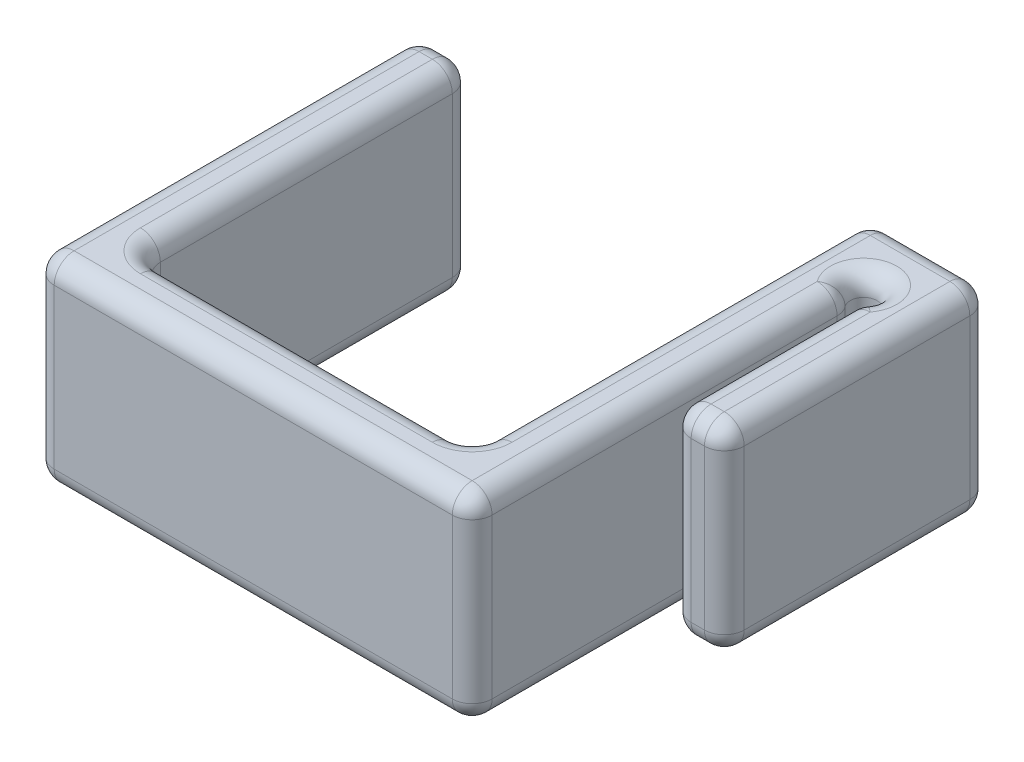
from build123d import *

# Parameters (mm, degrees)
SKETCH1_W           = 4
SKETCH1_H           = 25
BOSS_EXTRUDE1_DEPTH = 15
FILLET1_R           = 1.5
FILLET2_R           = 1.5


with BuildPart() as part:
    # Sketch1 → Boss-Extrude1 (new body)
    with BuildSketch(Plane(origin=(0, 0, 0), x_dir=(1, 0, 0), z_dir=(0, 1, 0))):
        with Locations((-29.683486239, -13.318807339)):
            Rectangle(SKETCH1_W, SKETCH1_H)
        Polygon((-2.683486239, -29.818807339), (-2.683486239, -25.818807339), (-27.683486239, -25.818807339), (-31.683486239, -25.818807339), (-31.683486239, -29.818807339), align=None)
        with BuildLine():
            Line((1.816513761, 0.181192661), (1.816513761, 4.181192661))
            Line((1.816513761, 4.181192661), (-2.683486239, 4.181192661))
            Line((-2.683486239, 4.181192661), (-2.683486239, -25.818807339))
            Line((-2.683486239, -25.818807339), (-2.683486239, -29.818807339))
            Line((-2.683486239, -29.818807339), (1.316513761, -29.818807339))
            Line((1.316513761, -29.818807339), (1.316513761, -1.684832743))
            ThreePointArc((1.316513761, -1.684832743), (0.850587935, -0.559988294), (1.816513761, 0.181192661))
        make_face()
        with BuildLine():
            Line((6.316513761, 4.181192661), (1.816513761, 4.181192661))
            Line((1.816513761, 4.181192661), (1.816513761, 0.181192661))
            ThreePointArc((1.816513761, 0.181192661), (2.523620543, -0.111700558), (2.816513761, -0.818807339))
            ThreePointArc((2.816513761, -0.818807339), (2.682539165, -1.318807339), (2.316513761, -1.684832743))
            Line((2.316513761, -1.684832743), (2.316513761, -15.818807339))
            Line((2.316513761, -15.818807339), (6.316513761, -15.818807339))
            Line((6.316513761, -15.818807339), (6.316513761, 4.181192661))
        make_face()
    extrude(amount=BOSS_EXTRUDE1_DEPTH)

    # Fillet1
    fillet1_edges = [part.edges().sort_by_distance(p)[0] for p in [
        (-15.183486239, 15, 29.818807339),
        (-29.683486239, 0, 0.818807339),
        (-27.683486239, 0, 13.318807339),
        (-15.183486239, 0, 25.818807339),
        (-2.683486239, 0, 10.818807339),
        (1.816513761, 0, -4.181192661),
        (6.316513761, 0, 5.818807339),
        (4.316513761, 0, 15.818807339),
        (-15.183486239, 0, 29.818807339),
        (-31.683486239, 0, 15.318807339),
        (-31.683486239, 7.5, 0.818807339),
        (-27.683486239, 7.5, 0.818807339),
        (-27.683486239, 7.5, 25.818807339),
        (-2.683486239, 7.5, 25.818807339),
        (-2.683486239, 7.5, -4.181192661),
        (6.316513761, 7.5, -4.181192661),
        (6.316513761, 7.5, 15.818807339),
        (2.316513761, 7.5, 15.818807339),
        (2.316513761, 7.5, 1.684832743),
        (1.316513761, 7.5, 1.684832743),
        (1.316513761, 7.5, 29.818807339),
        (-31.683486239, 7.5, 29.818807339),
        (4.316513761, 15, 15.818807339),
        (6.316513761, 15, 5.818807339),
        (1.816513761, 15, -4.181192661),
        (-31.683486239, 15, 15.318807339),
        (-2.683486239, 15, 10.818807339),
        (-15.183486239, 15, 25.818807339),
        (-27.683486239, 15, 13.318807339),
        (-29.683486239, 15, 0.818807339),
    ]]
    fillet(fillet1_edges, radius=FILLET1_R)

    # Fillet2
    # the kernel refuses this fillet: 1.5 mm, written as the material it takes off along each edge
    with BuildSketch(Plane(origin=(-0.183486239, 13.5, 28.318807339), x_dir=(1, 0, 0), z_dir=(0, 1, 0))) as fillet2_piece_1_section:
        Polygon((0, 0), (FILLET2_R, 0), (FILLET2_R, -FILLET2_R), (0, -FILLET2_R), align=None)
    fillet2_piece_1 = extrude(amount=FILLET2_R, mode=Mode.PRIVATE)
    fillet2_piece_1 = fillet2_piece_1 - Plane(origin=(-0.183486239, 13.5, 28.318807339), x_dir=(-0.7071067811865475, 0, -0.7071067811865475), z_dir=(0, 1, 0)) * Sphere(FILLET2_R, mode=Mode.PRIVATE)
    add(fillet2_piece_1, mode=Mode.SUBTRACT)
    with BuildSketch(Plane(origin=(-0.183486239, 1.5, 28.318807339), x_dir=(1, 0, 0), z_dir=(0, -1, 0))) as fillet2_piece_2_section:
        Polygon((0, 0), (FILLET2_R, 0), (FILLET2_R, FILLET2_R), (0, FILLET2_R), align=None)
    fillet2_piece_2 = extrude(amount=FILLET2_R, mode=Mode.PRIVATE)
    fillet2_piece_2 = fillet2_piece_2 - Plane(origin=(-0.183486239, 1.5, 28.318807339), x_dir=(-0.7071067811865475, 0, -0.7071067811865475), z_dir=(0, -1, 0)) * Sphere(FILLET2_R, mode=Mode.PRIVATE)
    add(fillet2_piece_2, mode=Mode.SUBTRACT)
    with BuildSketch(Plane(origin=(3.816513761, 13.5, 14.318807339), x_dir=(-1, 0, 0), z_dir=(0, 1, 0))) as fillet2_piece_3_section:
        Polygon((0, 0), (FILLET2_R, 0), (FILLET2_R, FILLET2_R), (0, FILLET2_R), align=None)
    fillet2_piece_3 = extrude(amount=FILLET2_R, mode=Mode.PRIVATE)
    fillet2_piece_3 = fillet2_piece_3 - Plane(origin=(3.816513761, 13.5, 14.318807339), x_dir=(0.7071067811865475, 0, -0.7071067811865477), z_dir=(0, 1, 0)) * Sphere(FILLET2_R, mode=Mode.PRIVATE)
    add(fillet2_piece_3, mode=Mode.SUBTRACT)
    with BuildSketch(Plane(origin=(3.816513761, 1.5, 14.318807339), x_dir=(-1, 0, 0), z_dir=(0, -1, 0))) as fillet2_piece_4_section:
        Polygon((0, 0), (FILLET2_R, 0), (FILLET2_R, -FILLET2_R), (0, -FILLET2_R), align=None)
    fillet2_piece_4 = extrude(amount=FILLET2_R, mode=Mode.PRIVATE)
    fillet2_piece_4 = fillet2_piece_4 - Plane(origin=(3.816513761, 1.5, 14.318807339), x_dir=(0.7071067811865475, 0, -0.7071067811865477), z_dir=(0, -1, 0)) * Sphere(FILLET2_R, mode=Mode.PRIVATE)
    add(fillet2_piece_4, mode=Mode.SUBTRACT)
    with BuildSketch(Plane(origin=(2.316513761, 0, 2.318807339), x_dir=(1, 0, 0), z_dir=(0, 0, 1))) as fillet2_piece_5:
        with BuildLine():
            CenterArc((FILLET2_R, FILLET2_R), FILLET2_R, 180, 90)
            Line((0, FILLET2_R), (0, 0))
            Line((0, 0), (FILLET2_R, 0))
        make_face()
    extrude(amount=12, mode=Mode.SUBTRACT)
    with BuildSketch(Plane(origin=(1.816513761, 0, 0.818807339), x_dir=(0.8000000000000007, 0, 0.5999999999999992), z_dir=(-0.5999999999999992, 0, 0.8000000000000007))) as fillet2_piece_6:
        with BuildLine():
            CenterArc((1 + FILLET2_R, FILLET2_R), FILLET2_R, 180, 90)
            Line((1, FILLET2_R), (1, 0))
            Line((1, 0), (1 + FILLET2_R, 0))
        make_face()
    revolve(axis=Axis((1.816513761, 0, 0.818807339), (0, 1, 0)), revolution_arc=253.739795292, mode=Mode.SUBTRACT)
    with BuildSketch(Plane(origin=(1.316513761, 0, 28.318807339), x_dir=(-1, 0, 0), z_dir=(0, 0, -1))) as fillet2_piece_7:
        with BuildLine():
            CenterArc((FILLET2_R, FILLET2_R), FILLET2_R, 180, 90)
            Line((0, FILLET2_R), (0, 0))
            Line((0, 0), (FILLET2_R, 0))
        make_face()
    extrude(amount=26, mode=Mode.SUBTRACT)
    with BuildSketch(Plane(origin=(3.816513761, 0, 2.318807339), x_dir=(-1, 0, 0), z_dir=(0, 0, 1))) as fillet2_piece_8:
        with BuildLine():
            CenterArc((1.5 - FILLET2_R, -FILLET2_R), FILLET2_R, 0, 90)
            Line((1.5, -FILLET2_R), (1.5, 0))
            Line((1.5, 0), (1.5 - FILLET2_R, 0))
        make_face()
    revolve(axis=Axis((3.816513761, 0, 2.318807339), (0, -1, 0)), revolution_arc=36.869897646, mode=Mode.SUBTRACT)
    with BuildSketch(Plane(origin=(-0.183486239, 0, 2.318807339), x_dir=(0.7999999999999999, 0, -0.6000000000000001), z_dir=(-0.6000000000000001, 0, -0.7999999999999999))) as fillet2_piece_9:
        with BuildLine():
            CenterArc((1.5 - FILLET2_R, -FILLET2_R), FILLET2_R, 0, 90)
            Line((1.5, -FILLET2_R), (1.5, 0))
            Line((1.5, 0), (1.5 - FILLET2_R, 0))
        make_face()
    revolve(axis=Axis((-0.183486239, 0, 2.318807339), (0, -1, 0)), revolution_arc=36.869897646, mode=Mode.SUBTRACT)
    with BuildSketch(Plane(origin=(1.316513761, 15, 28.318807339), x_dir=(-1, 0, 0), z_dir=(0, 0, -1))) as fillet2_piece_10:
        with BuildLine():
            CenterArc((FILLET2_R, -FILLET2_R), FILLET2_R, 90, 90)
            Line((0, -FILLET2_R), (0, 0))
            Line((0, 0), (FILLET2_R, 0))
        make_face()
    extrude(amount=26, mode=Mode.SUBTRACT)
    with BuildSketch(Plane(origin=(1.816513761, 15, 0.818807339), x_dir=(-0.8000000000000002, 0, 0.5999999999999998), z_dir=(0.5999999999999998, 0, 0.8000000000000002))) as fillet2_piece_11:
        with BuildLine():
            CenterArc((1 + FILLET2_R, FILLET2_R), FILLET2_R, 180, 90)
            Line((1, FILLET2_R), (1, 0))
            Line((1, 0), (1 + FILLET2_R, 0))
        make_face()
    revolve(axis=Axis((1.816513761, 15, 0.818807339), (0, -1, 0)), revolution_arc=253.739795292, mode=Mode.SUBTRACT)
    with BuildSketch(Plane(origin=(2.316513761, 15, 2.318807339), x_dir=(1, 0, 0), z_dir=(0, 0, 1))) as fillet2_piece_12:
        with BuildLine():
            CenterArc((FILLET2_R, -FILLET2_R), FILLET2_R, 90, 90)
            Line((0, -FILLET2_R), (0, 0))
            Line((0, 0), (FILLET2_R, 0))
        make_face()
    extrude(amount=12, mode=Mode.SUBTRACT)
    with BuildSketch(Plane(origin=(3.816513761, 15, 2.318807339), x_dir=(-1, 0, 0), z_dir=(0, 0, 1))) as fillet2_piece_13:
        with BuildLine():
            CenterArc((1.5 - FILLET2_R, FILLET2_R), FILLET2_R, 270, 90)
            Line((1.5, FILLET2_R), (1.5, 0))
            Line((1.5, 0), (1.5 - FILLET2_R, 0))
        make_face()
    revolve(axis=Axis((3.816513761, 15, 2.318807339), (0, -1, 0)), revolution_arc=36.869897646, mode=Mode.SUBTRACT)
    with BuildSketch(Plane(origin=(-0.183486239, 15, 2.318807339), x_dir=(0.7999999999999999, 0, -0.6000000000000001), z_dir=(-0.6000000000000001, 0, -0.7999999999999999))) as fillet2_piece_14:
        with BuildLine():
            CenterArc((1.5 - FILLET2_R, FILLET2_R), FILLET2_R, 270, 90)
            Line((1.5, FILLET2_R), (1.5, 0))
            Line((1.5, 0), (1.5 - FILLET2_R, 0))
        make_face()
    revolve(axis=Axis((-0.183486239, 15, 2.318807339), (0, -1, 0)), revolution_arc=36.869897646, mode=Mode.SUBTRACT)


solid = part.part
